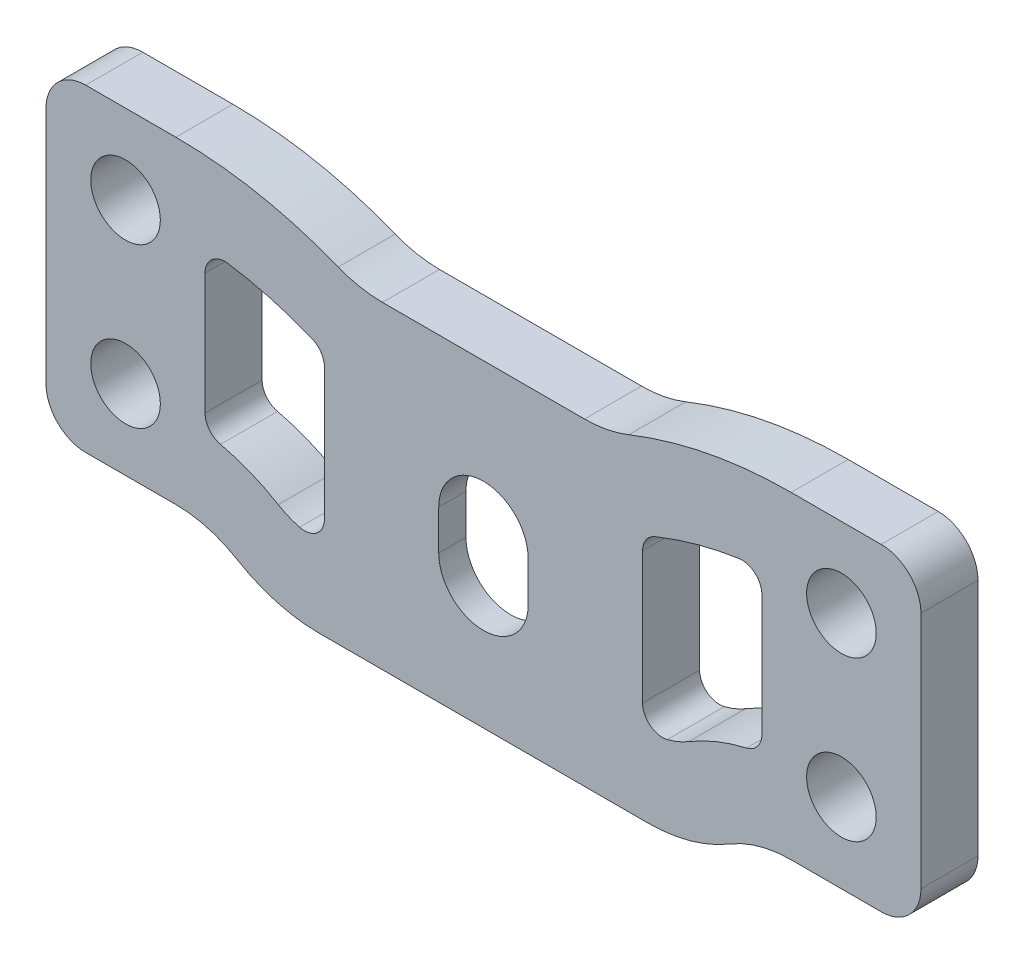
from build123d import *

# Parameters (mm, degrees)
SKETCH1_W                       = 69.85
SKETCH1_H                       = 25.4
BASE_FLANGE1_DEPTH              = 4.55422
F_7_32_0_21875_DIAMETER_HOLE1_D = 5.55625
BREAK_CORNER1_DEPTH             = 4.55422
SKETCH4_W                       = 34.925
SKETCH4_H                       = 3.175
TAB1_DEPTH                      = 4.55422
FILLET1_R                       = 9.525
CUT_EXTRUDE1_REACH              = 40.633
SKETCH7_R                       = 9.525
CUT_EXTRUDE3_DEPTH              = 2.38125
F_9_32_0_28125_DIAMETER_HOLE1_D = 7.14375
FILLET3_R                       = 12.7
CUT_EXTRUDE4_START              = -2.17297
CUT_EXTRUDE4_DEPTH              = 2.17297
CUT_EXTRUDE5_REACH              = 40.633


# Read off the part's stored shape, not the designer's step: Break-Corner1
# Sheet-metal steps are written as plain solids
with BuildPart() as part:
    # Sketch1 → Base-Flange1 (new body)
    with BuildSketch(Plane.XY):
        Rectangle(SKETCH1_W, SKETCH1_H)
    extrude(amount=BASE_FLANGE1_DEPTH)

    # 7/32 (0.21875) Diameter Hole1 (through all)
    with Locations(Plane.XY.offset(4.55422)):
        with Locations((-28.575, 6.35), (-28.575, -6.35), (28.575, 6.35), (28.575, -6.35)):
            Hole(F_7_32_0_21875_DIAMETER_HOLE1_D / 2)

    # Break-Corner1 outline → Break-Corner1 (cut)
    with BuildSketch(Plane.XY):
        with BuildLine():
            Line((34.925, -12.7), (34.925, -9.525))
            ThreePointArc((34.925, -9.525), (33.99506403, -11.77006403), (31.75, -12.7))
            Line((31.75, -12.7), (34.925, -12.7))
        make_face()
        with BuildLine():
            ThreePointArc((31.75, 12.7), (33.99506403, 11.77006403), (34.925, 9.525))
            Line((34.925, 9.525), (34.925, 12.7))
            Line((34.925, 12.7), (31.75, 12.7))
        make_face()
        with BuildLine():
            Line((-34.925, -12.7), (-31.75, -12.7))
            ThreePointArc((-31.75, -12.7), (-33.99506403, -11.77006403), (-34.925, -9.525))
            Line((-34.925, -9.525), (-34.925, -12.7))
        make_face()
        with BuildLine():
            ThreePointArc((-34.925, 9.525), (-33.99506403, 11.77006403), (-31.75, 12.7))
            Line((-31.75, 12.7), (-34.925, 12.7))
            Line((-34.925, 12.7), (-34.925, 9.525))
        make_face()
    extrude(amount=BREAK_CORNER1_DEPTH, mode=Mode.SUBTRACT)

    # Sketch4 → Tab1 (add)
    with BuildSketch(Plane(origin=(0, 0, 0), x_dir=(-1, 0, 0), z_dir=(0, 0, -1))):
        with Locations((0, -14.2875)):
            Rectangle(SKETCH4_W, SKETCH4_H)
    extrude(amount=-TAB1_DEPTH)

    # Fillet1
    # the kernel refuses this fillet: 9.525 mm, written as the material it adds along each edge
    with BuildSketch(Plane(origin=(-17.4625, -12.7, 0), x_dir=(-1, 0, 0), z_dir=(0, 0, 1))) as fillet1_piece_1:
        with BuildLine():
            CenterArc((7.099515829, 9.525), FILLET1_R, 221.810314896, 48.189685104)
            Line((0, 3.175), (-0.141990317, 3.048))
            ThreePointArc((-0.141990317, 3.048), (-0.1905, 1.5875), (-0.1905, 0))
            Line((-0.1905, 0), (0, -0.1905))
            Line((0, -0.1905), (7.099515829, -0.1905))
            Line((7.099515829, -0.1905), (7.099515829, 0))
        make_face()
    extrude(amount=4.55422)
    with BuildSketch(Plane(origin=(17.4625, -12.7, 0), x_dir=(1, 0, 0), z_dir=(0, 0, 1))) as fillet1_piece_2:
        with BuildLine():
            CenterArc((7.099515829, -9.525), FILLET1_R, 90, 48.189685104)
            Line((0, -3.175), (-0.141990317, -3.048))
            ThreePointArc((-0.141990317, -3.048), (-0.1905, -1.5875), (-0.1905, 0))
            Line((-0.1905, 0), (0, 0.1905))
            Line((0, 0.1905), (7.099515829, 0.1905))
            Line((7.099515829, 0.1905), (7.099515829, 0))
        make_face()
    extrude(amount=4.55422)

    # Sketch5 → Cut-Extrude1 (cut, up to next)
    with BuildSketch(Plane(origin=(0, 0, 0), x_dir=(-1, 0, 0), z_dir=(0, 0, -1)), mode=Mode.PRIVATE) as cut_extrude1_sk1:
        with BuildLine():
            Line((-8.064231886, 9.525), (8.064231886, 9.525))
            ThreePointArc((8.064231886, 9.525), (9.864287689, 9.69663568), (11.599471303, 10.205357143))
            ThreePointArc((11.599471303, 10.205357143), (17.961811219, 12.070669174), (24.562015829, 12.7))
            Line((24.562015829, 12.7), (-24.562015829, 12.7))
            ThreePointArc((-24.562015829, 12.7), (-17.961811219, 12.070669174), (-11.599471303, 10.205357143))
            ThreePointArc((-11.599471303, 10.205357143), (-9.864287689, 9.69663568), (-8.064231886, 9.525))
        make_face()
    cut_extrude1_tool1 = extrude(cut_extrude1_sk1.sketch, amount=-CUT_EXTRUDE1_REACH, mode=Mode.PRIVATE) & part.part
    add(cut_extrude1_tool1.solids().sort_by_distance((0, 11.328032, 0))[0], mode=Mode.SUBTRACT)

    # Sketch7 → Cut-Extrude3 (cut)
    with BuildSketch(Plane(origin=(0, 0, 0), x_dir=(-1, 0, 0), z_dir=(0, 0, -1))):
        with Locations((0, -3.175)):
            Circle(SKETCH7_R)
    extrude(amount=-CUT_EXTRUDE3_DEPTH, mode=Mode.SUBTRACT)

    # 9/32 (0.28125) Diameter Hole1 (through all)
    with Locations(Plane(origin=(0, 0, 2.38125), x_dir=(-1, 0, 0), z_dir=(0, 0, -1))):
        with Locations((0, -3.175)):
            Hole(F_9_32_0_28125_DIAMETER_HOLE1_D / 2)

    # Fillet3
    fillet3_edges = [part.edges().sort_by_distance(p)[0] for p in [
        (17.4625, -15.875, 2.27711),
        (-17.4625, -15.875, 2.27711),
    ]]
    fillet(fillet3_edges, radius=FILLET3_R)

    # Sketch10 → Cut-Extrude4 (cut)
    with BuildSketch(Plane.XY.offset(4.55422).offset(CUT_EXTRUDE4_START)):
        with BuildLine():
            Line((3.571875, -2.38125), (3.571875, -5.55625))
            ThreePointArc((3.571875, -5.55625), (0, -9.128125), (-3.571875, -5.55625))
            Line((-3.571875, -5.55625), (-3.571875, -2.38125))
            ThreePointArc((-3.571875, -2.38125), (0, 1.190625), (3.571875, -2.38125))
        make_face()
    extrude(amount=CUT_EXTRUDE4_DEPTH, mode=Mode.SUBTRACT)

    # Sketch11 → Cut-Extrude5 (cut, up to next)
    with BuildSketch(Plane(origin=(0, 0, 0), x_dir=(-1, 0, 0), z_dir=(0, 0, -1)), mode=Mode.PRIVATE) as cut_extrude5_sk1:
        with BuildLine():
            Line((-22.225, -5.20921081), (-22.225, 4.475624183))
            ThreePointArc((-22.225, 4.475624183), (-21.675207986, 5.677006048), (-20.406646128, 6.046249135))
            ThreePointArc((-20.406646128, 6.046249135), (-17.13052876, 5.366731097), (-13.95629758, 4.308928571))
            ThreePointArc((-13.95629758, 4.308928571), (-13.839204583, 4.262663683), (-13.721748353, 4.217328884))
            ThreePointArc((-13.721748353, 4.217328884), (-12.980157851, 3.634624239), (-12.7, 2.734061773))
            Line((-12.7, 2.734061773), (-12.7, -7.790757838))
            ThreePointArc((-12.7, -7.790757838), (-13.312978112, -9.043939125), (-14.67853649, -9.329343784))
            ThreePointArc((-14.67853649, -9.329343784), (-15.557873342, -9.03604869), (-16.385140615, -8.617857143))
            ThreePointArc((-16.385140615, -8.617857143), (-18.616383766, -7.505452304), (-20.994274166, -6.756100736))
            ThreePointArc((-20.994274166, -6.756100736), (-21.879783228, -6.197587575), (-22.225, -5.20921081))
        make_face()
    cut_extrude5_tool1 = extrude(cut_extrude5_sk1.sketch, amount=-CUT_EXTRUDE5_REACH, mode=Mode.PRIVATE) & part.part
    cut_extrude5 = cut_extrude5_tool1.solids().sort_by_distance((17.387748, -1.405717, 0))[0]
    add(cut_extrude5, mode=Mode.SUBTRACT)

    # Mirror1: Cut-Extrude5 across plane
    add(cut_extrude5.mirror(Plane(origin=(0, 0, 0), x_dir=(0, 0, 1), z_dir=(1, 0, 0))), mode=Mode.SUBTRACT)


solid = part.part
